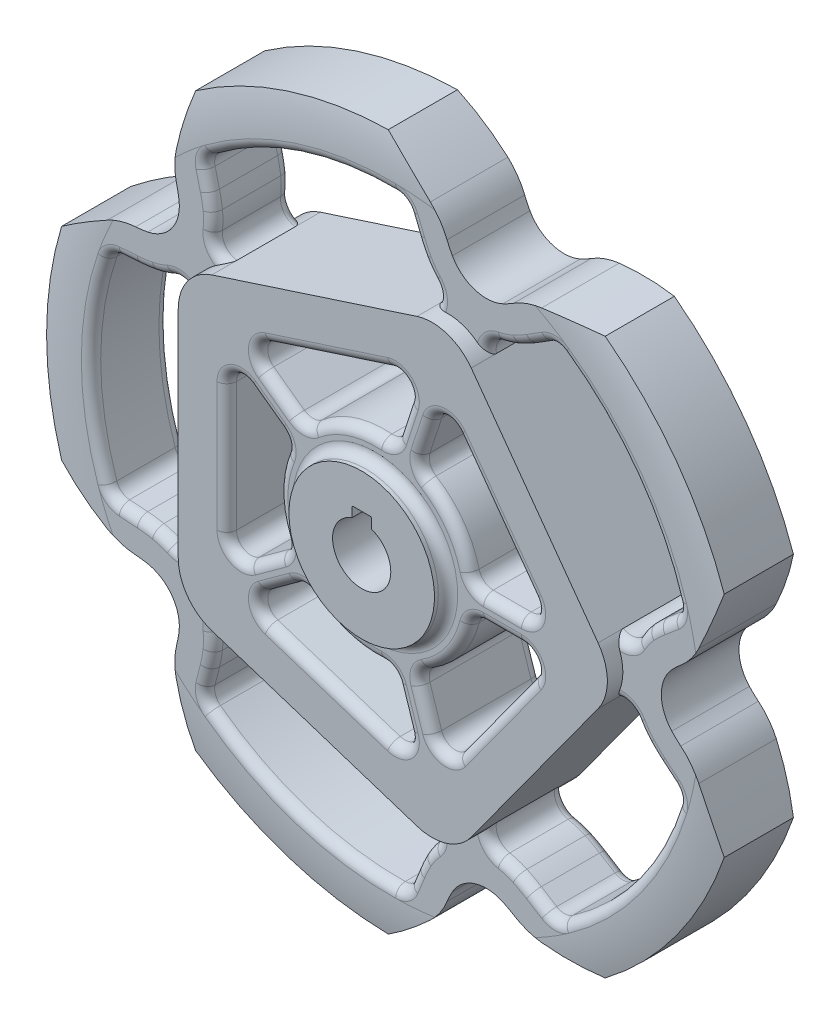
from build123d import *

# Parameters (mm, degrees)
BOSS_EXTRUDE1_DEPTH     = 8
CUT_EXTRUDE1_DEPTH      = 123.46319146981126
CUT_EXTRUDE1_DEPTH_BACK = 123.46319146981126
SKETCH2_OUTSIDE_W       = 208.84300000000002
SKETCH2_OUTSIDE_H       = 217.036
SKETCH2_OUTSIDE_R       = 71.82664999999974
BOSS_EXTRUDE2_DEPTH     = 11.2
FILLET2_R               = 10
SKETCH5_R               = 15
BOSS_EXTRUDE3_DEPTH     = 14
CUT_EXTRUDE2_DEPTH      = 103.52913283920887
CUT_EXTRUDE2_DEPTH_BACK = 103.52913283920887
FILLET10_R              = 0.25
CUT_EXTRUDE5_DEPTH      = 103.52913283920887
CUT_EXTRUDE5_DEPTH_BACK = 103.52913283920887
CUT_EXTRUDE6_DEPTH      = 103.52913283920887
CUT_EXTRUDE6_DEPTH_BACK = 103.52913283920887
FILLET7_R               = 1.9999999999999982
FILLET8_R               = 1.9999999999999982
FILLET9_R               = 2


with BuildPart() as part:
    # Sketch1 → Boss-Extrude1 (new, symmetric)
    with BuildSketch(Plane.XY):
        with BuildLine():
            ThreePointArc((12.69299582990417, 56.78537139050392), (14.608093935098275, 54.48217290293013), (17.234171342435484, 53.041325417471214))
            ThreePointArc((17.234171342435484, 53.041325417471214), (20.205621496271114, 52.663425948098364), (23.108754513366936, 53.40108624303787))
            ThreePointArc((23.108754513366936, 53.40108624303787), (24.2407335413463, 53.97188844446444), (25.33573812640086, 54.61075981778464))
            ThreePointArc((25.33573812640086, 54.61075981778464), (28.09948274632974, 55.944261275938814), (31.086450789042335, 56.647491234699764))
            ThreePointArc((31.086450789042335, 56.647491234699764), (51.63366631776492, 56.74117004124215), (71.63794377370455, 52.04801277045319))
            ThreePointArc((71.63794377370455, 52.04801277045319), (69.91973988400936, 31.57254898825744), (63.481207259148384, 12.05993411117922))
            ThreePointArc((63.481207259148384, 12.05993411117922), (61.88937193756175, 9.436468698402761), (59.76709263062478, 7.220065980837134))
            ThreePointArc((59.76709263062478, 7.220065980837134), (58.82111482225383, 6.376076846423528), (57.928448912149804, 5.475888396221733))
            ThreePointArc((57.928448912149804, 5.475888396221733), (56.32977484262175, 2.942794389853068), (55.77095000000008, -1.1102e-13))
            ThreePointArc((55.77095000000008, -1.1102e-13), (56.32977484262176, -2.942794389853246), (57.928448912149804, -5.475888396221921))
            ThreePointArc((57.928448912149804, -5.475888396221921), (58.82111482225382, -6.376076846423707), (59.767092630624774, -7.220065980837319))
            ThreePointArc((59.767092630624774, -7.220065980837319), (61.88937193756174, -9.43646869840295), (63.481207259148356, -12.059934111179421))
            ThreePointArc((63.481207259148356, -12.059934111179421), (69.9197398840093, -31.57254898825767), (71.63794377370442, -52.04801277045343))
            ThreePointArc((71.63794377370442, -52.04801277045343), (51.63366631776477, -56.74117004124231), (31.08645078904218, -56.64749123469987))
            ThreePointArc((31.08645078904218, -56.64749123469987), (28.099482746329592, -55.94426127593893), (25.335738126400713, -54.610759817784746))
            ThreePointArc((25.335738126400713, -54.610759817784746), (24.240733541346152, -53.97188844446455), (23.108754513366783, -53.40108624303796))
            ThreePointArc((23.108754513366783, -53.40108624303796), (20.20562149627104, -52.66342594809845), (17.234171342435467, -53.041325417471214))
            ThreePointArc((17.234171342435467, -53.041325417471214), (14.608093935097695, -54.482172902930074), (12.69299582990319, -56.78537139050413))
            ThreePointArc((12.69299582990319, -56.78537139050413), (12.112714674966462, -57.912520650435496), (11.60235652808828, -59.073005994958905))
            ThreePointArc((11.60235652808828, -59.073005994958905), (10.150252653467001, -61.776319665326255), (8.147092943987557, -64.10094041749281))
            ThreePointArc((8.147092943987557, -64.10094041749281), (-8.420890584895943, -76.25407842745629), (-27.36325963740172, -84.2154537094817))
            ThreePointArc((-27.36325963740172, -84.2154537094817), (-38.008379135860395, -66.64052063518214), (-44.2687240819195, -47.07000907163517))
            ThreePointArc((-44.2687240819195, -47.07000907163517), (-44.52293653403898, -44.01192364243725), (-44.10874533844271, -40.97137169968481))
            ThreePointArc((-44.10874533844271, -40.97137169968481), (-43.83951758147244, -39.732538342119994), (-43.646453185211726, -38.479574730583316))
            ThreePointArc((-43.646453185211726, -38.479574730583316), (-43.842013994110914, -35.490581589790764), (-45.11964634243574, -32.78134191634064))
            ThreePointArc((-45.11964634243574, -32.78134191634064), (-47.30147627988029, -30.72904024510585), (-50.08374607020902, -29.61940118689521))
            ThreePointArc((-50.08374607020902, -29.61940118689521), (-51.33504545709498, -29.415829289725288), (-52.59644194667205, -29.28905954167327))
            ThreePointArc((-52.59644194667205, -29.28905954167327), (-55.61617080332038, -28.74339655464688), (-58.446026910259654, -27.55662577766268))
            ThreePointArc((-58.446026910259654, -27.55662577766268), (-75.12413648101891, -15.55506326071005), (-88.54936827260663, 7.7716e-13))
            ThreePointArc((-88.54936827260663, 7.7716e-13), (-75.12413648101864, 15.555063260711364), (-58.44602691025916, 27.55662577766369))
            ThreePointArc((-58.44602691025916, 27.55662577766369), (-55.616170803319875, 28.743396554647845), (-52.59644194667154, 29.289059541674185))
            ThreePointArc((-52.59644194667154, 29.289059541674185), (-51.33504545709446, 29.415829289726183), (-50.08374607020849, 29.619401186896077))
            ThreePointArc((-50.08374607020849, 29.619401186896077), (-47.30147627987977, 30.729040245106646), (-45.1196463424352, 32.78134191634137))
            ThreePointArc((-45.1196463424352, 32.78134191634137), (-43.8420139941103, 35.490581589791496), (-43.64645318521106, 38.479574730584076))
            ThreePointArc((-43.64645318521106, 38.479574730584076), (-43.83951758147175, 39.73253834212075), (-44.108745338442, 40.97137169968556))
            ThreePointArc((-44.108745338442, 40.97137169968556), (-44.52293653403822, 44.01192364243802), (-44.2687240819187, 47.07000907163593))
            ThreePointArc((-44.2687240819187, 47.07000907163593), (-38.00837913585924, 66.64052063518281), (-27.363259637400265, 84.21545370948219))
            ThreePointArc((-27.363259637400265, 84.21545370948219), (-8.420890584894629, 76.25407842745646), (8.147092943988657, 64.1009404174927))
            ThreePointArc((8.147092943988657, 64.1009404174927), (10.150252653468058, 61.7763196653261), (11.602356528089295, 59.07300599495872))
            ThreePointArc((11.602356528089295, 59.07300599495872), (12.11271467496746, 57.9125206504353), (12.69299582990417, 56.78537139050392))
        make_face()
    extrude(amount=BOSS_EXTRUDE1_DEPTH, both=True)

    # Sketch2 outside → Cut-Extrude1 (cut, two sides: drawn at the far end of the back side and taken through both)
    with BuildSketch(Plane.XY.offset(-CUT_EXTRUDE1_DEPTH_BACK)):
        with Locations((-8.430499999999995, 0)):
            Rectangle(SKETCH2_OUTSIDE_W, SKETCH2_OUTSIDE_H)
        Circle(SKETCH2_OUTSIDE_R, mode=Mode.SUBTRACT)
    extrude(amount=CUT_EXTRUDE1_DEPTH + CUT_EXTRUDE1_DEPTH_BACK, mode=Mode.SUBTRACT)

    # Sketch3 → Cut-Revolve1 (revolve, cut)
    with BuildSketch(Plane(origin=(0, 0, 0), x_dir=(1, 0, 0), z_dir=(0, 1, 0))):
        with BuildLine():
            ThreePointArc((-63.7988, -8.000000000000021), (-76.0462487139159, -5.943617196894579), (-86.95047380558046, -1.421e-14))
            Line((-86.95047380558046, -1.243e-14), (-86.95047380558046, -8.000000000000021))
            Line((-86.95047380558046, -8.000000000000021), (-63.7988, -8.000000000000014))
        make_face()
        with BuildLine():
            ThreePointArc((-86.95047380558046, -1.066e-14), (-76.0462487139159, 5.943617196894564), (-63.7988, 8))
            Line((-63.7988, 8), (-86.95047380558046, 8))
            Line((-86.95047380558046, 8), (-86.95047380558046, -1.243e-14))
        make_face()
    revolve(axis=Axis((0, 0, 0), (0, 0, -1)), mode=Mode.SUBTRACT)

    # Sketch4 → Boss-Extrude2 (add, symmetric)
    with BuildSketch(Plane.XY):
        Polygon((50.202900906153964, -1.388e-14), (15.513549546923015, 47.74579604371762), (-40.61500000000002, 29.508524774937747), (-40.61500000000002, -29.508524774937747), (15.513549546923024, -47.74579604371761), align=None)
    extrude(amount=BOSS_EXTRUDE2_DEPTH, both=True)

    # Fillet2
    fillet2_edges = [part.edges().sort_by_distance(p)[0] for p in [
        (15.513549546923024, -47.74579604371761, -9.599999999999998),
        (50.202900906153964, -1.388e-14, -9.599999999999998),
        (15.513549546923015, 47.74579604371762, -9.6),
        (-40.61500000000002, 29.508524774937747, -9.6),
        (-40.61500000000002, -29.508524774937747, -9.599999999999998),
        (15.513549546923024, -47.74579604371761, 9.6),
        (50.202900906153964, -1.388e-14, 9.6),
        (15.513549546923015, 47.74579604371762, 9.599999999999998),
        (-40.61500000000002, 29.508524774937747, 9.599999999999998),
        (-40.61500000000002, -29.508524774937747, 9.6),
    ]]
    fillet(fillet2_edges, radius=FILLET2_R)

    # Sketch5 → Boss-Extrude3 (add)
    with BuildSketch(Plane.XY):
        Circle(SKETCH5_R)
    extrude(amount=BOSS_EXTRUDE3_DEPTH)

    # Sketch6 → Cut-Extrude2 (cut, two sides: drawn at the far end of the back side and taken through both)
    with BuildSketch(Plane.XY.offset(-CUT_EXTRUDE2_DEPTH_BACK)):
        with BuildLine():
            Line((1.9999999999999996, 7.800000000000001), (-2.0000000000000004, 7.800000000000001))
            Line((-2.0000000000000004, 7.800000000000001), (-2, 5.6568542494924134))
            ThreePointArc((-1.999999999999948, 5.656854249492399), (-1.532e-14, -6.000000000000001), (1.9999999999999774, 5.656854249492389))
            Line((2, 5.656854249492396), (1.9999999999999996, 7.800000000000001))
        make_face()
    extrude(amount=CUT_EXTRUDE2_DEPTH + CUT_EXTRUDE2_DEPTH_BACK, mode=Mode.SUBTRACT)

    # Fillet10
    fillet10_edges = [part.edges().sort_by_distance(p)[0] for p in [
        (1.9999999999999996, 7.800000000000001, 1.4000000000000057),
        (-2.0000000000000004, 7.800000000000001, 1.4000000000000057),
    ]]
    fillet(fillet10_edges, radius=FILLET10_R)

    # Sketch7 → Cut-Extrude5 (cut, two sides: drawn at the far end of the back side and taken through both)
    with BuildSketch(Plane.XY.offset(-CUT_EXTRUDE5_DEPTH_BACK)):
        with BuildLine():
            Line((19.784059378171573, 41.86794352079285), (45.932391074905595, 5.8778525229246315))
            ThreePointArc((45.932391074905595, 5.8778525229246315), (48.56601863176623, 5.5900811801269725), (50.63357322753679, 7.246590898631309))
            ThreePointArc((50.63357322753679, 7.246590898631309), (51.62859624590009, 8.816031772073101), (52.809711315538976, 10.250668539542305))
            ThreePointArc((52.809711315538976, 10.250668539542305), (54.00354868903719, 11.454566440274478), (55.26868455837177, 12.583304258313435))
            ThreePointArc((55.26868455837177, 12.583304258313435), (56.699991892865, 13.784225476851134), (58.130891052292796, 14.985633007397835))
            ThreePointArc((58.130891052292796, 14.985633007397835), (59.078794816552715, 16.433835703420137), (59.06891910280999, 18.16464911489535))
            ThreePointArc((59.06891910280999, 18.16464911489535), (49.99627943198893, 36.32442324937947), (35.52890774906374, 50.564695149878034))
            ThreePointArc((35.52890774906374, 50.564695149878034), (33.88585813896728, 51.108938270024055), (32.215617155810754, 50.65494746257446))
            ThreePointArc((32.215617155810754, 50.65494746257446), (30.630838537656018, 49.66533683694797), (29.04639629667864, 48.6751877350913))
            ThreePointArc((29.04639629667864, 48.6751877350913), (27.5819543558264, 47.820771190529506), (26.068063375450187, 47.05738928788593))
            ThreePointArc((26.068063375450187, 47.05738928788593), (24.338658100401215, 46.3774092463146), (22.538552108305918, 45.916070022396696))
            ThreePointArc((22.538552108305918, 45.916070022396696), (20.324208239324975, 44.461598405658215), (19.784059378171573, 41.86794352079285))
        make_face()
        with BuildLine():
            Line((45.93239107490555, -5.877852522925001), (19.784059378171246, -41.86794352079302))
            ThreePointArc((19.784059378171246, -41.86794352079302), (20.324208239324626, -44.46159840565838), (22.538552108305552, -45.91607002239688))
            ThreePointArc((22.538552108305552, -45.91607002239688), (24.338658100400842, -46.3774092463148), (26.068063375449807, -47.057389287886146))
            ThreePointArc((26.068063375449807, -47.057389287886146), (27.58195435582612, -47.820771190529754), (29.046396296678655, -48.67518773509129))
            ThreePointArc((29.046396296678655, -48.67518773509129), (30.630838537658747, -49.66533683694979), (32.21561715581034, -50.65494746257471))
            ThreePointArc((32.21561715581034, -50.65494746257471), (33.88585813896686, -51.10893827002432), (35.52890774906332, -50.56469514987831))
            ThreePointArc((35.52890774906332, -50.56469514987831), (49.99627943198863, -36.32442324937987), (59.06891910280985, -18.164649114895838))
            ThreePointArc((59.06891910280985, -18.164649114895838), (59.078794816552595, -16.43383570342062), (58.130891052292675, -14.985633007398306))
            ThreePointArc((58.130891052292675, -14.985633007398306), (56.699991892864546, -13.784225476851134), (55.26868455837175, -12.583304258313424))
            ThreePointArc((55.26868455837175, -12.583304258313424), (54.003548689037046, -11.454566440274816), (52.809711315538905, -10.250668539542739))
            ThreePointArc((52.809711315538905, -10.250668539542739), (51.62859624590003, -8.816031772073524), (50.63357322753674, -7.246590898631719))
            ThreePointArc((50.63357322753674, -7.246590898631719), (48.566018631766184, -5.590081180127367), (45.93239107490555, -5.877852522925001))
        make_face()
        with BuildLine():
            Line((8.603719490672109, -45.50065616081976), (-33.705169943749766, -31.75366465783539))
            ThreePointArc((-33.705169943749766, -31.75366465783539), (-36.004967145433056, -33.068860188971705), (-36.703981967393496, -35.624282802292434))
            ThreePointArc((-36.703981967393496, -35.624282802292434), (-36.58647829928957, -37.478846996459), (-36.698762128624836, -39.33373454129085))
            ThreePointArc((-36.698762128624836, -39.33373454129085), (-36.956963420988615, -41.00942840425343), (-37.31702439632528, -42.66622468738188))
            ThreePointArc((-37.31702439632528, -42.66622468738188), (-37.769092572681984, -44.47909170479829), (-38.22054468144796, -46.292112237608926))
            ThreePointArc((-38.22054468144796, -46.292112237608926), (-38.13618274871413, -48.0208966832151), (-37.110846530729525, -49.41534934829679))
            ThreePointArc((-37.110846530729525, -49.41534934829679), (-19.096879431982945, -58.774151439232895), (0.977691935190355, -61.79106569659921))
            ThreePointArc((0.977691935190355, -61.79106569659921), (2.626845072042994, -61.2656073002694), (3.7112493108229296, -59.9165780040788))
            ThreePointArc((3.7112493108229296, -59.9165780040788), (4.411683613976493, -58.18445669023481), (5.1115292738915645, -56.452097457510284))
            ThreePointArc((5.1115292738915645, -56.452097457510284), (5.7940742471080675, -54.900082577013116), (6.5701331536224785, -53.3926508527325))
            ThreePointArc((6.5701331536224785, -53.3926508527325), (7.569569171009933, -51.82601652735492), (8.75471711816821, -50.39470950031667))
            ThreePointArc((8.75471711816821, -50.39470950031667), (9.69124197336691, -47.91645857484799), (8.603719490672109, -45.50065616081976))
        make_face()
        with BuildLine():
            Line((-33.7051699437495, 31.753664657835674), (8.60371949067249, 45.500656160819695))
            ThreePointArc((8.60371949067249, 45.500656160819695), (9.691241973367315, 47.916458574847915), (8.75471711816863, 50.39470950031661))
            ThreePointArc((8.75471711816863, 50.39470950031661), (7.569569171010366, 51.82601652735486), (6.570133153622926, 53.39265085273245))
            ThreePointArc((6.570133153622926, 53.39265085273245), (5.794074247108455, 54.90008257701315), (5.111529273891559, 56.452097457510284))
            ThreePointArc((5.111529273891559, 56.452097457510284), (4.411683613976493, 58.184456690234356), (3.7112493108234292, 59.91657800407878))
            ThreePointArc((3.7112493108234292, 59.91657800407878), (2.626845072043505, 61.26560730026939), (0.9776919351908719, 61.79106569659921))
            ThreePointArc((0.9776919351908719, 61.79106569659921), (-19.096879431982455, 58.77415143923307), (-37.11084653072912, 49.41534934829713))
            ThreePointArc((-37.11084653072912, 49.41534934829713), (-38.13618274871373, 48.02089668321543), (-38.22054468144758, 46.29211223760927))
            ThreePointArc((-38.22054468144758, 46.29211223760927), (-37.769092572681984, 44.479091704798975), (-37.31702439632528, 42.66622468738186))
            ThreePointArc((-37.31702439632528, 42.66622468738186), (-36.956963420988274, 41.009428404253626), (-36.69876212862451, 39.33373454129118))
            ThreePointArc((-36.69876212862451, 39.33373454129118), (-36.586478299289254, 37.47884699645932), (-36.7039819673932, 35.624282802292754))
            ThreePointArc((-36.7039819673932, 35.624282802292754), (-36.004967145432786, 33.06886018897201), (-33.7051699437495, 31.753664657835674))
        make_face()
        with BuildLine():
            Line((-40.61500000000028, -22.243099494883683), (-40.61499999999979, 22.243099494884586))
            ThreePointArc((-40.61499999999979, 22.243099494884586), (-42.57650169902533, 24.023918839655746), (-45.22286048661775, 23.899052425741967))
            ThreePointArc((-45.22286048661775, 23.899052425741967), (-46.95034521802202, 23.214207943346395), (-48.74914571598718, 22.74780443690282))
            ThreePointArc((-48.74914571598718, 22.74780443690282), (-50.42261387098354, 22.47555057749597), (-52.109585732616715, 22.306010706649435))
            ThreePointArc((-52.109585732616715, 22.306010706649435), (-53.97342147181598, 22.175746374659866), (-55.837212837478994, 22.044848688707667))
            ThreePointArc((-55.837212837478994, 22.044848688707667), (-57.45531527884937, 21.430391949550526), (-58.46467225633508, 20.024329686681167))
            ThreePointArc((-58.46467225633508, 20.024329686681167), (-61.79880000001276, 6.9367e-13), (-58.46467225633555, -20.024329686679867))
            ThreePointArc((-58.46467225633555, -20.024329686679867), (-57.45531527884985, -21.430391949549247), (-55.837212837479484, -22.044848688706427))
            ThreePointArc((-55.837212837479484, -22.044848688706427), (-53.97342147181661, -22.175746374659866), (-52.109585732616694, -22.306010706649467))
            ThreePointArc((-52.109585732616694, -22.306010706649467), (-50.42261387098377, -22.475550577494968), (-48.749145715987694, -22.747804436901735))
            ThreePointArc((-48.749145715987694, -22.747804436901735), (-46.95034521802254, -23.21420794334535), (-45.22286048661828, -23.899052425740962))
            ThreePointArc((-45.22286048661828, -23.899052425740962), (-42.57650169902586, -24.02391883965479), (-40.61500000000028, -22.243099494883683))
        make_face()
    extrude(amount=CUT_EXTRUDE5_DEPTH + CUT_EXTRUDE5_DEPTH_BACK, mode=Mode.SUBTRACT)

    # Sketch8 → Cut-Extrude6 (cut, two sides: drawn at the far end of the back side and taken through both)
    with BuildSketch(Plane.XY.offset(-CUT_EXTRUDE6_DEPTH_BACK)):
        with BuildLine():
            Line((6.935523174339878, 29.435515439112862), (4.5235460728791335, 22.012213221903423))
            ThreePointArc((4.5235460728791335, 22.012213221903423), (3.3443771694107247, 20.449741793170258), (1.4525013252118888, 19.947186265241974))
            ThreePointArc((1.4525013252118888, 19.947186265241974), (-6.180339887498959, 19.02113032590308), (-12.899760167888768, 15.283853820648458))
            ThreePointArc((-12.899760167888768, 15.283853820648458), (-14.725714604867381, 14.578413062971064), (-16.5980799499495, 15.149380910620879))
            Line((-16.5980799499495, 15.149380910620879), (-22.912717981660197, 19.737233989618765))
            ThreePointArc((-22.912717981660197, 19.737233989618765), (-24.112427246568238, 22.63358836786433), (-22.076413207907613, 25.017454521629112))
            Line((-22.076413207907613, 25.017454521629112), (3.1553026423295423, 33.215735971123195))
            ThreePointArc((3.1553026423295423, 33.215735971123195), (6.203673969014076, 32.48388676579739), (6.935523174339878, 29.435515439112862))
        make_face()
        with BuildLine():
            Line((11.690805755815758, 27.890430467238087), (9.278828654354987, 20.46712825002865))
            ThreePointArc((9.278828654354987, 20.46712825002865), (9.314398673561696, 18.5099642195376), (10.549563654991696, 16.991371536438095))
            ThreePointArc((10.549563654991696, 16.991371536438095), (16.180339887498988, 11.755705045849428), (19.419749073154193, 4.782608695652141))
            ThreePointArc((19.419749073154193, 4.782608695652141), (20.482329569895423, 3.138626044752352), (22.332711434127308, 2.4999999999999587))
            Line((22.332711434127308, 2.4999999999999587), (30.13803329462721, 2.499999999999943))
            ThreePointArc((30.13803329462721, 2.499999999999943), (32.811052867192366, 4.1380285007812985), (32.56508427775208, 7.263355756877396))
            Line((32.56508427775208, 7.263355756877396), (16.97102628782611, 28.726735240990653))
            ThreePointArc((16.97102628782611, 28.726735240990653), (14.074671909580548, 29.9264445058987), (11.690805755815758, 27.890430467238087))
        make_face()
        with BuildLine():
            Line((30.13803329462717, -2.5000000000001723), (22.33271143412728, -2.500000000000129))
            ThreePointArc((22.33271143412728, -2.500000000000129), (20.48232956989539, -3.138626044752507), (19.419749073154147, -4.7826086956522875))
            ThreePointArc((19.419749073154147, -4.7826086956522875), (16.180339887498892, -11.75570504584955), (10.549563654991562, -16.991371536438173))
            ThreePointArc((10.549563654991562, -16.991371536438173), (9.31439867356155, -18.509964219537675), (9.278828654354829, -20.467128250028725))
            Line((9.278828654354829, -20.467128250028725), (11.690805755815544, -27.890430467238176))
            ThreePointArc((11.690805755815544, -27.890430467238176), (14.074671909580315, -29.926444505898804), (16.971026287825882, -28.726735240990784))
            Line((16.971026287825882, -28.726735240990784), (32.56508427775201, -7.263355756877645))
            ThreePointArc((32.56508427775201, -7.263355756877645), (32.811052867192316, -4.1380285007815445), (30.13803329462717, -2.5000000000001723))
        make_face()
        with BuildLine():
            Line((6.935523174339644, -29.435515439112912), (4.523546072878958, -22.012213221903455))
            ThreePointArc((4.523546072878958, -22.012213221903455), (3.344377169410561, -20.449741793170283), (1.4525013252117291, -19.94718626524198))
            ThreePointArc((1.4525013252117291, -19.94718626524198), (-6.18033988749911, -19.021130325903027), (-12.899760167888891, -15.283853820648359))
            ThreePointArc((-12.899760167888891, -15.283853820648359), (-14.725714604867498, -14.57841306297095), (-16.59807994994962, -15.14938091062075))
            Line((-16.59807994994962, -15.14938091062075), (-22.91271798166036, -19.737233989618588))
            ThreePointArc((-22.91271798166036, -19.737233989618588), (-24.112427246568412, -22.63358836786414), (-22.07641320790782, -25.017454521628935))
            Line((-22.07641320790782, -25.017454521628935), (3.155302642329277, -33.215735971123216))
            ThreePointArc((3.155302642329277, -33.215735971123216), (6.203673969013819, -32.483886765797436), (6.935523174339644, -29.435515439112912))
        make_face()
        with BuildLine():
            Line((-25.85164424312274, -15.692149017743736), (-19.537006211411992, -11.10429593874592))
            ThreePointArc((-19.537006211411992, -11.10429593874592), (-18.41539080800051, -9.50000944458584), (-18.52205388546903, -7.545430396192228))
            ThreePointArc((-18.52205388546903, -7.545430396192228), (-20, 2.1561e-13), (-18.522053885468868, 7.545430396192626))
            ThreePointArc((-18.522053885468868, 7.545430396192626), (-18.415390808000303, 9.500009444586237), (-19.53700621141175, 11.104295938746342))
            Line((-19.53700621141175, 11.104295938746342), (-25.8516442431224, 15.692149017744297))
            ThreePointArc((-25.8516442431224, 15.692149017744297), (-28.9769714992185, 15.938117607184624), (-30.61499999999989, 13.265098034619486))
            Line((-30.61499999999989, 13.265098034619486), (-30.615000000000173, -13.265098034618822))
            ThreePointArc((-30.615000000000173, -13.265098034618822), (-28.97697149921884, -15.938117607184), (-25.85164424312274, -15.692149017743736))
        make_face()
    extrude(amount=CUT_EXTRUDE6_DEPTH + CUT_EXTRUDE6_DEPTH_BACK, mode=Mode.SUBTRACT)

    # Fillet7
    fillet7_edges = [part.edges().sort_by_distance(p)[0] for p in [
        (-14.7257146048675, -14.57841306297095, 11.2),
        (-6.180339887499111, -19.021130325903023, 11.2),
        (3.344377169410561, -20.449741793170283, 11.2),
        (5.7295346236093, -25.72386433050818, 11.2),
        (6.203673969013816, -32.483886765797436, 11.2),
        (-9.460555282789269, -29.11659524637608, 11.2),
        (-24.112427246568412, -22.63358836786414, 11.2),
        (-19.755398965804993, -17.44330745011967, 11.2),
        (-14.7257146048675, -14.57841306297095, -11.2),
        (-6.180339887499111, -19.021130325903023, -11.2),
        (3.344377169410561, -20.449741793170283, -11.2),
        (5.7295346236093, -25.72386433050818, -11.2),
        (6.203673969013816, -32.483886765797436, -11.2),
        (-9.460555282789269, -29.11659524637608, -11.2),
        (-24.112427246568412, -22.63358836786414, -11.2),
        (-19.755398965804993, -17.44330745011967, -11.2),
        (-18.415390808000303, 9.500009444586238, 11.2),
        (-20, 2.1561e-13, 11.2),
        (-18.41539080800051, -9.50000944458584, 11.2),
        (-22.694325227267367, -13.39822247824483, 11.2),
        (-28.976971499218845, -15.938117607184, 11.2),
        (-30.61500000000003, 3.3307e-13, 11.2),
        (-28.9769714992185, 15.938117607184624, 11.2),
        (-22.694325227267075, 13.39822247824532, 11.2),
        (-18.415390808000303, 9.500009444586238, -11.2),
        (-20, 2.1561e-13, -11.2),
        (-18.41539080800051, -9.50000944458584, -11.2),
        (-22.694325227267367, -13.39822247824483, -11.2),
        (-28.976971499218845, -15.938117607184, -11.2),
        (-30.61500000000003, 3.3307e-13, -11.2),
        (-28.9769714992185, 15.938117607184624, -11.2),
        (-22.694325227267075, 13.39822247824532, -11.2),
        (9.314398673561552, -18.509964219537675, 11.2),
        (16.180339887498892, -11.755705045849552, 11.2),
        (20.48232956989539, -3.138626044752508, 11.2),
        (26.235372364377227, -2.5000000000001505, 11.2),
        (32.811052867192316, -4.138028500781544, 11.2),
        (24.768055282788943, -17.995045498934214, 11.2),
        (14.074671909580315, -29.926444505898804, 11.2),
        (10.484817205085188, -24.178779358633456, 11.2),
        (9.314398673561552, -18.509964219537675, -11.2),
        (16.180339887498892, -11.755705045849552, -11.2),
        (20.48232956989539, -3.138626044752508, -11.2),
        (26.235372364377227, -2.5000000000001505, -11.2),
        (32.811052867192316, -4.138028500781544, -11.2),
        (24.768055282788943, -17.995045498934214, -11.2),
        (14.074671909580315, -29.926444505898804, -11.2),
        (10.484817205085188, -24.178779358633456, -11.2),
        (20.482329569895427, 3.13862604475235, 11.2),
        (16.180339887498988, 11.755705045849428, 11.2),
        (9.314398673561696, 18.5099642195376, 11.2),
        (10.484817205085372, 24.17877935863337, 11.2),
        (14.074671909580548, 29.9264445058987, 11.2),
        (24.768055282789092, 17.995045498934022, 11.2),
        (32.811052867192366, 4.138028500781299, 11.2),
        (26.23537236437726, 2.4999999999999507, 11.2),
        (20.482329569895427, 3.13862604475235, -11.2),
        (16.180339887498988, 11.755705045849428, -11.2),
        (9.314398673561696, 18.5099642195376, -11.2),
        (10.484817205085372, 24.17877935863337, -11.2),
        (14.074671909580548, 29.9264445058987, -11.2),
        (24.768055282789092, 17.995045498934022, -11.2),
        (32.811052867192366, 4.138028500781299, -11.2),
        (26.23537236437726, 2.4999999999999507, -11.2),
        (-6.1803398874989695, 19.021130325903073, 11.2),
        (-14.725714604867383, 14.578413062971062, 11.2),
        (-19.75539896580485, 17.443307450119825, 11.2),
        (-24.112427246568238, 22.633588367864327, 11.2),
        (-9.460555282789038, 29.116595246376153, 11.2),
        (6.2036739690140745, 32.48388676579739, 11.2),
        (5.729534623609506, 25.723864330508142, 11.2),
        (3.344377169410726, 20.44974179317026, 11.2),
        (-6.1803398874989695, 19.021130325903073, -11.2),
        (-14.725714604867383, 14.578413062971062, -11.2),
        (-19.75539896580485, 17.443307450119825, -11.2),
        (-24.112427246568238, 22.633588367864327, -11.2),
        (-9.460555282789038, 29.116595246376153, -11.2),
        (6.2036739690140745, 32.48388676579739, -11.2),
        (5.729534623609506, 25.723864330508142, -11.2),
        (3.344377169410726, 20.44974179317026, -11.2),
    ]]
    fillet(fillet7_edges, radius=FILLET7_R)

    # Fillet8
    fillet8_edges = [part.edges().sort_by_distance(p)[0] for p in [
        (-15, -8.5e-15, 11.2),
    ]]
    fillet(fillet8_edges, radius=FILLET8_R)

    # Fillet9
    fillet9_edges = [part.edges().sort_by_distance(p)[0] for p in [
        (5.794074247108465, 54.90008257701314, 8),
        (4.411683613976493, 58.18445669023231, 8),
        (2.6268450720435053, 61.26560730026939, 8),
        (-19.096879431982472, 58.774151439233066, 8),
        (-38.13618274871373, 48.02089668321543, 8),
        (-37.769092572681984, 44.47909170479852, 8),
        (-36.95696342098827, 41.009428404253605, 8),
        (-36.586478299289254, 37.47884699645932, 8),
        (7.569569171010361, 51.82601652735487, 8),
        (54.003548689037174, 11.454566440274464, 8),
        (56.699991892863636, 13.784225476850224, 8),
        (59.078794816552715, 16.43383570342014, 8),
        (49.99627943198894, 36.324423249379464, 8),
        (33.88585813896728, 51.108938270024055, 8),
        (30.630838537655563, 49.66533683694706, 8),
        (27.581954355826376, 47.8207711905295, 8),
        (24.338658100401215, 46.3774092463146, 8),
        (51.62859624590009, 8.816031772073107, 8),
        (27.581954355826102, -47.82077119052975, 8),
        (30.63083853765511, -49.66533683694888, 8),
        (33.88585813896686, -51.10893827002432, 8),
        (49.99627943198863, -36.324423249379876, 8),
        (59.078794816552595, -16.433835703420616, 8),
        (56.699991892863636, -13.784225476852043, 8),
        (54.00354868903703, -11.454566440274792, 8),
        (51.62859624590003, -8.81603177207353, 8),
        (24.338658100400842, -46.3774092463148, 8),
        (-36.956963420988615, -41.009428404253406, 8),
        (-37.769092572681984, -44.479091704798066, 8),
        (-38.13618274871413, -48.0208966832151, 8),
        (-19.096879431982963, -58.774151439232895, 8),
        (2.6268450720429954, -61.2656073002694, 8),
        (4.411683613977402, -58.184456690230945, 8),
        (5.794074247108078, -54.90008257701309, 8),
        (7.569569171009933, -51.82601652735492, 8),
        (-36.58647829928957, -37.478846996459, 8),
        (-50.422613870983525, 22.475550577495973, 8),
        (-53.97342147181706, 22.175746374659866, 8),
        (-57.45531527884937, 21.430391949550526, 8),
        (-61.79880000001275, 6.7857e-13, 8),
        (-57.45531527884985, -21.430391949549247, 8),
        (-53.97342147181632, -22.175746374658956, 8),
        (-50.422613870983724, -22.475550577494968, 8),
        (-46.95034521802254, -23.21420794334535, 8),
        (-46.95034521802202, 23.214207943346395, 8),
        (-46.95034521802202, 23.214207943346395, -8),
        (-46.95034521802254, -23.21420794334535, -8),
        (-50.422613870983724, -22.475550577494968, -8),
        (-53.97342147181632, -22.175746374658956, -8),
        (-57.45531527884985, -21.430391949549247, -8),
        (-61.79880000001275, 6.7857e-13, -8),
        (-57.45531527884937, 21.430391949550526, -8),
        (-53.97342147181706, 22.175746374659866, -8),
        (-50.422613870983525, 22.475550577495973, -8),
        (-42.576501699025336, 24.023918839655746, -8),
        (-42.576501699025336, 24.023918839655746, 8),
        (-42.57650169902587, -24.02391883965479, -8),
        (-42.57650169902587, -24.02391883965479, 8),
        (-36.58647829928957, -37.478846996459, -8),
        (7.569569171009933, -51.82601652735492, -8),
        (5.794074247108078, -54.90008257701309, -8),
        (4.411683613977402, -58.184456690230945, -8),
        (2.6268450720429954, -61.2656073002694, -8),
        (-19.096879431982963, -58.774151439232895, -8),
        (-38.13618274871413, -48.0208966832151, -8),
        (-37.769092572681984, -44.479091704798066, -8),
        (-36.956963420988615, -41.009428404253406, -8),
        (9.691241973366912, -47.916458574847994, -8),
        (9.691241973366912, -47.916458574847994, 8),
        (-36.00496714543306, -33.06886018897171, -8),
        (-36.00496714543306, -33.06886018897171, 8),
        (24.338658100400842, -46.3774092463148, -8),
        (51.62859624590003, -8.81603177207353, -8),
        (54.00354868903703, -11.454566440274792, -8),
        (56.699991892863636, -13.784225476852043, -8),
        (59.078794816552595, -16.433835703420616, -8),
        (49.99627943198863, -36.324423249379876, -8),
        (33.88585813896686, -51.10893827002432, -8),
        (30.63083853765511, -49.66533683694888, -8),
        (27.581954355826102, -47.82077119052975, -8),
        (48.56601863176619, -5.5900811801273695, -8),
        (48.56601863176619, -5.5900811801273695, 8),
        (20.324208239324633, -44.461598405658386, -8),
        (20.324208239324633, -44.461598405658386, 8),
        (51.62859624590009, 8.816031772073107, -8),
        (24.338658100401215, 46.3774092463146, -8),
        (27.581954355826376, 47.8207711905295, -8),
        (30.630838537655563, 49.66533683694706, -8),
        (33.88585813896728, 51.108938270024055, -8),
        (49.99627943198894, 36.324423249379464, -8),
        (59.078794816552715, 16.43383570342014, -8),
        (56.699991892863636, 13.784225476850224, -8),
        (54.003548689037174, 11.454566440274464, -8),
        (20.324208239324975, 44.46159840565822, -8),
        (20.324208239324975, 44.46159840565822, 8),
        (48.566018631766234, 5.5900811801269725, -8),
        (48.566018631766234, 5.5900811801269725, 8),
        (7.569569171010361, 51.82601652735487, -8),
        (-36.586478299289254, 37.47884699645932, -8),
        (-36.95696342098827, 41.009428404253605, -8),
        (-37.769092572681984, 44.47909170479852, -8),
        (-38.13618274871373, 48.02089668321543, -8),
        (-19.096879431982472, 58.774151439233066, -8),
        (2.6268450720435053, 61.26560730026939, -8),
        (4.411683613976493, 58.18445669023231, -8),
        (5.794074247108465, 54.90008257701314, -8),
        (-36.00496714543279, 33.06886018897202, -8),
        (-36.00496714543279, 33.06886018897202, 8),
        (9.691241973367317, 47.91645857484792, -8),
        (9.691241973367317, 47.91645857484792, 8),
    ]]
    fillet(fillet9_edges, radius=FILLET9_R - 0.0001)  # a hair under: the kernel refuses the full size


solid = part.part
